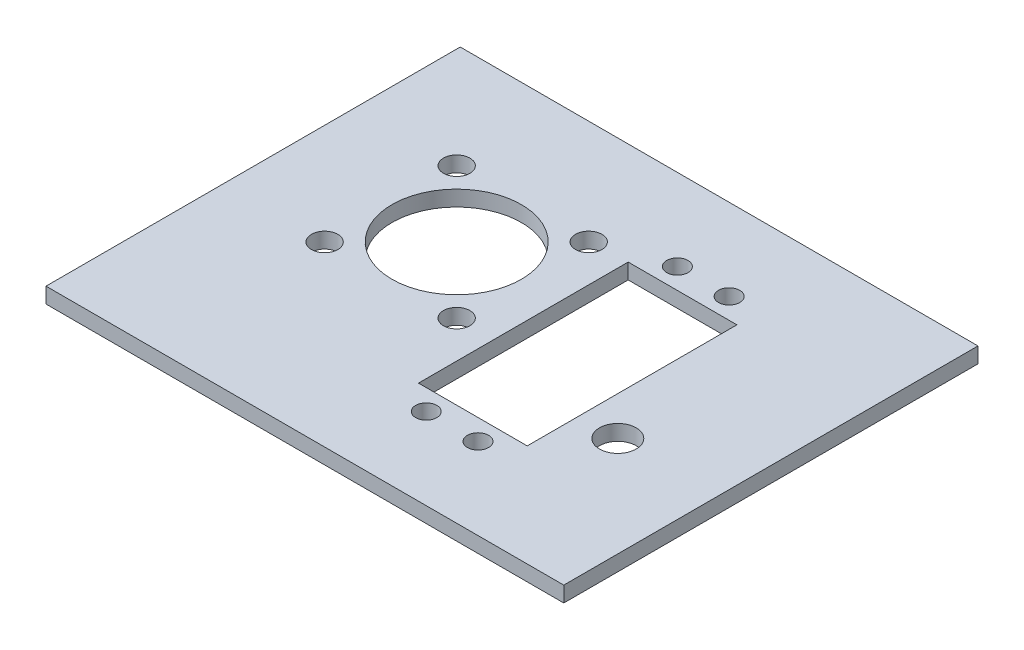
from build123d import *

# Parameters (mm, degrees)
SZKIC1_W                    = 100
SZKIC1_H                    = 80
SZKIC1_R                    = 2.55
SZKIC1_R_2                  = 2.05
SZKIC1_R_3                  = 3.55
SZKIC1_R_4                  = 12.5
SZKIC1_W_2                  = 21
SZKIC1_H_2                  = 40.5
DODANIE_WYCI_GNI_CIE1_DEPTH = 3


with BuildPart() as part:
    # Szkic1 → Dodanie-wyciągnięcie1 (new body)
    with BuildSketch(Plane(origin=(0, 0, 0), x_dir=(1, 0, 0), z_dir=(0, 1, 0))):
        with Locations((11.336719097, -8.838965942)):
            Rectangle(SZKIC1_W, SZKIC1_H)
        with Locations((-19.149495477, -14.537434265)):
            Circle(SZKIC1_R, mode=Mode.SUBTRACT)
        with Locations((6.350504523, -14.537434265)):
            Circle(SZKIC1_R, mode=Mode.SUBTRACT)
        with Locations((19.025116298, -33.088965942)):
            Circle(SZKIC1_R_2, mode=Mode.SUBTRACT)
        with Locations((29.025116298, -33.088965942)):
            Circle(SZKIC1_R_2, mode=Mode.SUBTRACT)
        with Locations((42.025116298, -19.088965942)):
            Circle(SZKIC1_R_3, mode=Mode.SUBTRACT)
        with Locations((-19.149495477, 10.962565735)):
            Circle(SZKIC1_R, mode=Mode.SUBTRACT)
        with Locations((-6.399495477, -1.787434265)):
            Circle(SZKIC1_R_4, mode=Mode.SUBTRACT)
        with Locations((6.350504523, 10.962565735)):
            Circle(SZKIC1_R, mode=Mode.SUBTRACT)
        with Locations((24.025116298, -8.838965942)):
            Rectangle(SZKIC1_W_2, SZKIC1_H_2, mode=Mode.SUBTRACT)
        with Locations((19.025116298, 15.411034058)):
            Circle(SZKIC1_R_2, mode=Mode.SUBTRACT)
        with Locations((29.025116298, 15.411034058)):
            Circle(SZKIC1_R_2, mode=Mode.SUBTRACT)
    extrude(amount=DODANIE_WYCI_GNI_CIE1_DEPTH)


solid = part.part
